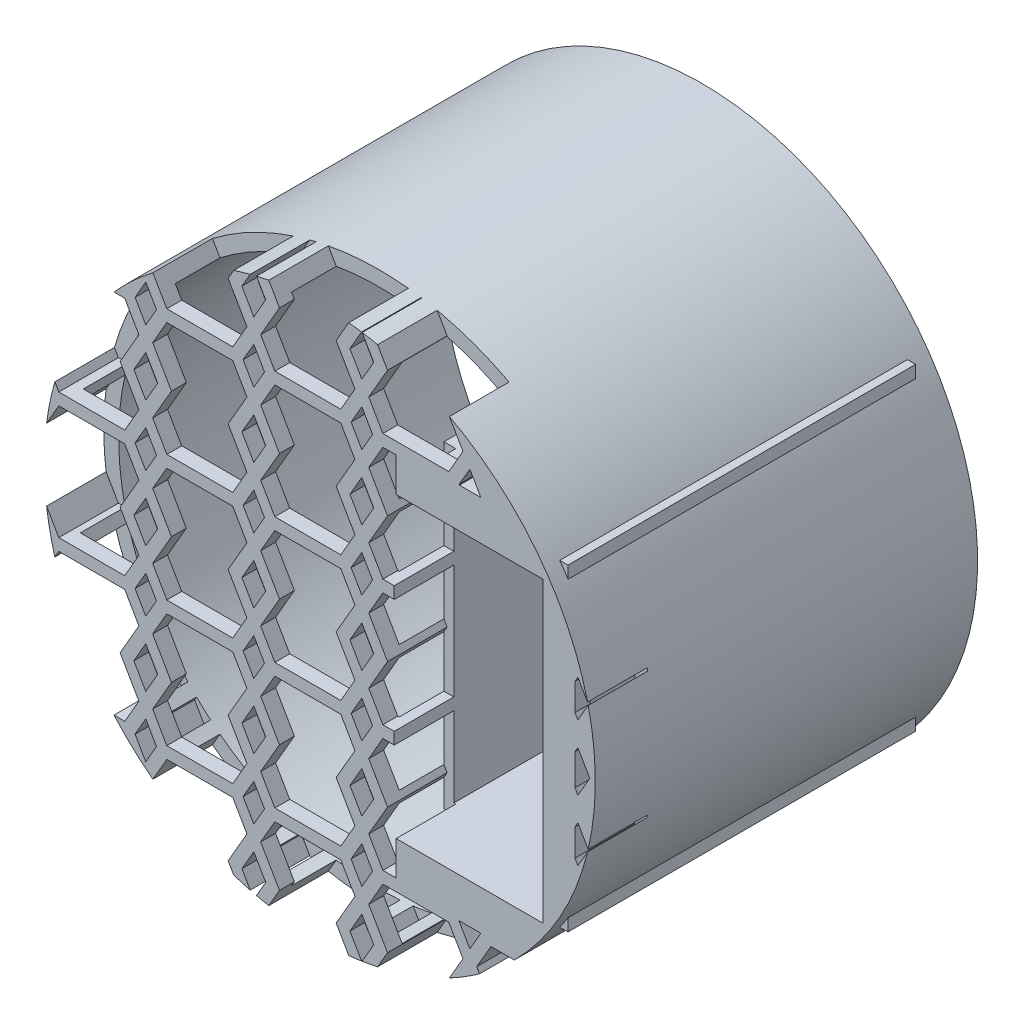
from build123d import *
from build123d.topology import SkipClean

# Parameters (mm, degrees)
SKETCH1_R           = 55.5
SKETCH1_W           = 30
SKETCH1_H           = 60
BOSS_EXTRUDE1_DEPTH = 3
SKETCH2_W           = 34
SKETCH2_H           = 64
SKETCH2_W_2         = 30
SKETCH2_H_2         = 60
BOSS_EXTRUDE2_DEPTH = 70
BOSS_EXTRUDE3_START = 74
SKETCH3_R           = 55.5
SKETCH3_R_2         = 52.5
BOSS_EXTRUDE3_DEPTH = 74
BOSS_EXTRUDE7_START = 3
BOSS_EXTRUDE7_DEPTH = 3
SKETCH7_R           = 1.5
BOSS_EXTRUDE8_DEPTH = 3
CUT_EXTRUDE1_DEPTH  = 12
CUT_EXTRUDE2_DEPTH  = 12


with BuildPart() as part:
    # Sketch1 → Boss-Extrude1 (new body)
    with BuildSketch(Plane.XY):
        Circle(SKETCH1_R)
        with Locations((30, 0)):
            Rectangle(SKETCH1_W, SKETCH1_H, mode=Mode.SUBTRACT)
    extrude(amount=BOSS_EXTRUDE1_DEPTH)

    # Sketch2 → Boss-Extrude2 (add)
    with BuildSketch(Plane(origin=(0, 0, 0), x_dir=(-1, 0, 0), z_dir=(0, 0, -1))):
        with Locations((-30, 0)):
            Rectangle(SKETCH2_W, SKETCH2_H)
        with Locations((-30, 0)):
            Rectangle(SKETCH2_W_2, SKETCH2_H_2, mode=Mode.SUBTRACT)
    extrude(amount=BOSS_EXTRUDE2_DEPTH)

    # Sketch3 → Boss-Extrude3 (add)
    with SkipClean():  # the faces are left unmerged after this step: merging them gives an invalid solid
        with BuildSketch(Plane(origin=(0, 0, 0), x_dir=(-1, 0, 0), z_dir=(0, 0, -1)).offset(BOSS_EXTRUDE3_START)):
            Circle(SKETCH3_R)
            with Locations(Location((0, 0, 0), (0, 0, 153.539028773))):
                Circle(SKETCH3_R_2, mode=Mode.SUBTRACT)
        extrude(amount=-BOSS_EXTRUDE3_DEPTH)
    add(part.part.scale(1), mode=Mode.REPLACE)  # the faces are merged on a copy

    # Sketch4 → Boss-Extrude7 (add)
    with BuildSketch(Plane(origin=(0, 0, -70), x_dir=(-1, 0, 0), z_dir=(0, 0, -1)).offset(BOSS_EXTRUDE7_START)):
        with BuildLine():
            Line((-43.084219849, -30), (-47, 23.393375131))
            ThreePointArc((-47, 23.393375131), (-46.036153719, 25.237324557), (-45, 27.041634566))
            Line((-45, 27.041634566), (-16.4, 37))
            Line((-16.4, 37), (-16.4, -37))
            Line((-16.4, -37), (-41.620307543, -32))
            ThreePointArc((-41.620307543, -32), (-42.364067796, -31.008640083), (-43.084219849, -30))
        make_face()
    extrude(amount=-BOSS_EXTRUDE7_DEPTH)

    # Sketch7 → Boss-Extrude8 (add)
    # profile 1 of 3: a face of its own
    with SkipClean():  # the faces are left unmerged after this step: merging them gives an invalid solid
        with BuildSketch(Plane(origin=(0, 0, -74), x_dir=(-1, 0, 0), z_dir=(0, 0, -1))):
            with BuildLine():
                Line((-10, -51.53882032), (-10, -39.53882032))
                Line((-10, -39.53882032), (10, -39.53882032))
                Line((10, -39.53882032), (10, -51.53882032))
                ThreePointArc((10, -51.53882032), (0, -52.5), (-10, -51.53882032))
            make_face()
            with Locations((0, -45)):
                Circle(SKETCH7_R, mode=Mode.SUBTRACT)
        # profile 2 of 3: a face of its own
        with BuildSketch(Plane(origin=(0, 0, -74), x_dir=(-1, 0, 0), z_dir=(0, 0, -1))):
            with BuildLine():
                Line((10, 51.53882032), (10, 39.53882032))
                Line((10, 39.53882032), (-10, 39.53882032))
                Line((-10, 39.53882032), (-10, 51.53882032))
                ThreePointArc((-10, 51.53882032), (0, 52.5), (10, 51.53882032))
            make_face()
            with Locations((0, 45)):
                Circle(SKETCH7_R, mode=Mode.SUBTRACT)
        # profile 3 of 3: a face of its own
        with BuildSketch(Plane(origin=(0, 0, -74), x_dir=(-1, 0, 0), z_dir=(0, 0, -1))):
            with BuildLine():
                Line((51.53882032, -10), (39.53882032, -10))
                Line((39.53882032, -10), (39.53882032, 10))
                Line((39.53882032, 10), (51.53882032, 10))
                ThreePointArc((51.53882032, 10), (52.5, 0), (51.53882032, -10))
            make_face()
            with Locations((45, 0)):
                Circle(SKETCH7_R, mode=Mode.SUBTRACT)
        extrude(amount=-BOSS_EXTRUDE8_DEPTH)

    # Sketch9 → Cut-Extrude1 (cut)
    with SkipClean():  # the faces are left unmerged after this step: merging them gives an invalid solid
        with BuildSketch(Plane.XY.offset(3)):
            with BuildLine():
                Line((-52.560824722, 13.9), (-39.281768531, 13.9))
                Line((-39.281768531, 13.9), (-36.427881081, 18.843078062))
                Line((-36.427881081, 18.843078062), (-40.213521727, 25.4))
                Line((-40.213521727, 25.4), (-36.427881081, 31.956921938))
                Line((-36.427881081, 31.956921938), (-39.281768531, 36.9))
                Line((-39.281768531, 36.9), (-43.444102016, 36.9))
                ThreePointArc((-43.444102016, 36.9), (-49.910820133, 27.530165884), (-54.386447784, 17.062071898))
                Line((-54.386447784, 17.062071898), (-52.560824722, 13.9))
            make_face()
            Polygon((-35.042240435, 16.443078062), (-37.203307562, 12.7), (-35.042240435, 8.956921938), (-32.881173308, 12.7), align=None)
            Polygon((-37.442240435, 25.4), (-35.042240435, 21.243078062), (-32.642240435, 25.4), (-35.042240435, 29.556921938), align=None)
            Polygon((-30.802712339, 11.5), (-33.656599789, 6.556921938), (-29.870959143, 0), (-33.656599789, -6.556921938), (-30.802712339, -11.5), (-17.523656148, -11.5), (-14.669768698, -6.556921938), (-18.455409344, 0), (-14.669768698, 6.556921938), (-17.523656148, 11.5), align=None)
            with BuildLine():
                Line((-40.213521727, 0), (-36.427881081, 6.556921938))
                Line((-36.427881081, 6.556921938), (-39.281768531, 11.5))
                Line((-39.281768531, 11.5), (-52.560824722, 11.5))
                Line((-52.560824722, 11.5), (-56.855069607, 4.06214968))
                ThreePointArc((-56.855069607, 4.06214968), (-57, 0), (-56.855069607, -4.06214968))
                Line((-56.855069607, -4.06214968), (-52.560824722, -11.5))
                Line((-52.560824722, -11.5), (-39.281768531, -11.5))
                Line((-39.281768531, -11.5), (-36.427881081, -6.556921938))
                Line((-36.427881081, -6.556921938), (-40.213521727, 0))
            make_face()
            Polygon((-29.870959143, 25.4), (-33.656599789, 18.843078062), (-30.802712339, 13.9), (-17.523656148, 13.9), (-14.669768698, 18.843078062), (-18.455409344, 25.4), (-14.669768698, 31.956921938), (-17.523656148, 36.9), (-30.802712339, 36.9), (-33.656599789, 31.956921938), align=None)
            Polygon((-32.642240435, 0), (-35.042240435, 4.156921938), (-37.442240435, 0), (-35.042240435, -4.156921938), align=None)
            Polygon((-37.203307562, 38.1), (-35.042240435, 34.356921938), (-32.881173308, 38.1), (-35.042240435, 41.843078062), align=None)
            Polygon((-10.884128052, 0), (-13.284128052, 4.156921938), (-15.684128052, 0), (-13.284128052, -4.156921938), align=None)
            Polygon((-15.445195179, 12.7), (-13.284128052, 8.956921938), (-11.123060926, 12.7), (-13.284128052, 16.443078062), align=None)
            Polygon((-15.684128052, 25.4), (-13.284128052, 21.243078062), (-10.884128052, 25.4), (-13.284128052, 29.556921938), align=None)
            with BuildLine():
                Line((-31.94545962, 47.206859774), (-33.656599789, 44.243078062))
                Line((-33.656599789, 44.243078062), (-30.802712339, 39.3))
                Line((-30.802712339, 39.3), (-17.523656148, 39.3))
                Line((-17.523656148, 39.3), (-14.669768698, 44.243078062))
                Line((-14.669768698, 44.243078062), (-18.455409344, 50.8))
                Line((-18.455409344, 50.8), (-16.239753763, 54.637628039))
                ThreePointArc((-16.239753763, 54.637628039), (-24.377402988, 51.524190664), (-31.94545962, 47.206859774))
            make_face()
            Polygon((-9.044599957, 11.5), (-11.898487406, 6.556921938), (-8.11284676, 0), (-11.898487406, -6.556921938), (-9.044599957, -11.5), (4.234456235, -11.5), (7.088343684, -6.556921938), (3.302703038, 0), (7.088343684, 6.556921938), (4.234456235, 11.5), align=None)
            Polygon((-8.11284676, 25.4), (-11.898487406, 18.843078062), (-9.044599957, 13.9), (4.234456235, 13.9), (7.088343684, 18.843078062), (3.302703038, 25.4), (7.088343684, 31.956921938), (4.234456235, 36.9), (-9.044599957, 36.9), (-11.898487406, 31.956921938), align=None)
            Polygon((-15.445195179, 38.1), (-13.284128052, 34.356921938), (-11.123060926, 38.1), (-13.284128052, 41.843078062), align=None)
            Polygon((12.713512426, -11.5), (15.4, -11.5), (15.4, 11.5), (12.713512426, 11.5), (9.859624977, 6.556921938), (13.645265623, 0), (9.859624977, -6.556921938), align=None)
            Polygon((-15.684128052, 50.8), (-13.284128052, 46.643078062), (-10.884128052, 50.8), (-13.284128052, 54.956921938), align=None)
            with BuildLine():
                Line((-8.11284676, 50.8), (-11.898487406, 44.243078062))
                Line((-11.898487406, 44.243078062), (-9.044599957, 39.3))
                Line((-9.044599957, 39.3), (4.234456235, 39.3))
                Line((4.234456235, 39.3), (7.088343684, 44.243078062))
                Line((7.088343684, 44.243078062), (3.302703038, 50.8))
                Line((3.302703038, 50.8), (6.657064227, 56.609924005))
                ThreePointArc((6.657064227, 56.609924005), (-2.23177374, 56.956291891), (-11.066255472, 55.915453945))
                Line((-11.066255472, 55.915453945), (-8.11284676, 50.8))
            make_face()
            Polygon((10.873984331, 0), (8.473984331, 4.156921938), (6.073984331, 0), (8.473984331, -4.156921938), align=None)
            Polygon((6.312917204, 12.7), (8.473984331, 8.956921938), (10.635051457, 12.7), (8.473984331, 16.443078062), align=None)
            Polygon((6.073984331, 25.4), (8.473984331, 21.243078062), (10.873984331, 25.4), (8.473984331, 29.556921938), align=None)
            Polygon((12.713512426, 13.9), (15.4, 13.9), (15.4, 36.9), (12.713512426, 36.9), (9.859624977, 31.956921938), (13.645265623, 25.4), (9.859624977, 18.843078062), align=None)
            Polygon((51.4, -3.134649797), (51.990209096, -4.156921938), (54.390209096, 0), (51.990209096, 4.156921938), (51.4, 3.134649797), align=None)
            Polygon((6.312917204, 38.1), (8.473984331, 34.356921938), (10.635051457, 38.1), (8.473984331, 41.843078062), align=None)
            Polygon((6.073984331, 50.8), (8.473984331, 46.643078062), (10.873984331, 50.8), (8.473984331, 54.956921938), align=None)
            Polygon((51.4, 15.420805921), (51.4, 9.979194079), (51.990209096, 8.956921938), (54.151276223, 12.7), (51.990209096, 16.443078062), align=None)
            with BuildLine():
                Line((13.645265623, 50.8), (9.859624977, 44.243078062))
                Line((9.859624977, 44.243078062), (12.713512426, 39.3))
                Line((12.713512426, 39.3), (25.992568618, 39.3))
                Line((25.992568618, 39.3), (28.846456067, 44.243078062))
                Line((28.846456067, 44.243078062), (25.060815421, 50.8))
                Line((25.060815421, 50.8), (25.238566441, 51.107873797))
                ThreePointArc((25.238566441, 51.107873797), (18.107387911, 54.047409772), (10.644633075, 55.997248028))
                Line((10.644633075, 55.997248028), (13.645265623, 50.8))
            make_face()
            Polygon((30.232096713, 41.843078062), (28.071029587, 38.1), (28.128764614, 38), (32.335428813, 38), (32.39316384, 38.1), align=None)
        extrude(amount=-CUT_EXTRUDE1_DEPTH, mode=Mode.SUBTRACT)

    # Sketch10 → Cut-Extrude2 (cut)
    with SkipClean():  # the faces are left unmerged after this step: merging them gives an invalid solid
        with BuildSketch(Plane.XY.offset(3)):
            with BuildLine():
                Line((-39.281768531, -36.9), (-36.427881081, -31.956921938))
                Line((-36.427881081, -31.956921938), (-40.213521727, -25.4))
                Line((-40.213521727, -25.4), (-36.427881081, -18.843078062))
                Line((-36.427881081, -18.843078062), (-39.281768531, -13.9))
                Line((-39.281768531, -13.9), (-52.560824722, -13.9))
                Line((-52.560824722, -13.9), (-54.386447784, -17.062071898))
                ThreePointArc((-54.386447784, -17.062071898), (-49.910820133, -27.530165884), (-43.444102016, -36.9))
                Line((-43.444102016, -36.9), (-39.281768531, -36.9))
            make_face()
            Polygon((-17.523656148, -36.9), (-14.669768698, -31.956921938), (-18.455409344, -25.4), (-14.669768698, -18.843078062), (-17.523656148, -13.9), (-30.802712339, -13.9), (-33.656599789, -18.843078062), (-29.870959143, -25.4), (-33.656599789, -31.956921938), (-30.802712339, -36.9), align=None)
            Polygon((-37.442240435, -25.4), (-35.042240435, -29.556921938), (-32.642240435, -25.4), (-35.042240435, -21.243078062), align=None)
            Polygon((-35.042240435, -16.443078062), (-32.881173308, -12.7), (-35.042240435, -8.956921938), (-37.203307562, -12.7), align=None)
            Polygon((-13.284128052, -16.443078062), (-11.123060926, -12.7), (-13.284128052, -8.956921938), (-15.445195179, -12.7), align=None)
            Polygon((8.473984331, -16.443078062), (10.635051457, -12.7), (8.473984331, -8.956921938), (6.312917204, -12.7), align=None)
            Polygon((4.234456235, -36.9), (7.088343684, -31.956921938), (3.302703038, -25.4), (7.088343684, -18.843078062), (4.234456235, -13.9), (-9.044599957, -13.9), (-11.898487406, -18.843078062), (-8.11284676, -25.4), (-11.898487406, -31.956921938), (-9.044599957, -36.9), align=None)
            Polygon((6.073984331, -25.4), (8.473984331, -29.556921938), (10.873984331, -25.4), (8.473984331, -21.243078062), align=None)
            Polygon((-15.684128052, -25.4), (-13.284128052, -29.556921938), (-10.884128052, -25.4), (-13.284128052, -21.243078062), align=None)
            Polygon((12.713512426, -36.9), (15.4, -36.9), (15.4, -13.9), (12.713512426, -13.9), (9.859624977, -18.843078062), (13.645265623, -25.4), (9.859624977, -31.956921938), align=None)
            with BuildLine():
                ThreePointArc((-31.94545962, -47.206859774), (-24.377402988, -51.524190664), (-16.239753763, -54.637628039))
                Line((-16.239753763, -54.637628039), (-18.455409344, -50.8))
                Line((-18.455409344, -50.8), (-14.669768698, -44.243078062))
                Line((-14.669768698, -44.243078062), (-17.523656148, -39.3))
                Line((-17.523656148, -39.3), (-30.802712339, -39.3))
                Line((-30.802712339, -39.3), (-33.656599789, -44.243078062))
                Line((-33.656599789, -44.243078062), (-31.94545962, -47.206859774))
            make_face()
            Polygon((-37.203307562, -38.1), (-35.042240435, -41.843078062), (-32.881173308, -38.1), (-35.042240435, -34.356921938), align=None)
            with BuildLine():
                ThreePointArc((-41.285711814, -39.3), (-39.137603015, -41.439691483), (-36.87875912, -43.462134391))
                Line((-36.87875912, -43.462134391), (-39.281768531, -39.3))
                Line((-39.281768531, -39.3), (-41.285711814, -39.3))
            make_face()
            Polygon((-15.445195179, -38.1), (-13.284128052, -41.843078062), (-11.123060926, -38.1), (-13.284128052, -34.356921938), align=None)
            with BuildLine():
                ThreePointArc((-11.066255472, -55.915453945), (-2.23177374, -56.956291891), (6.657064227, -56.609924005))
                Line((6.657064227, -56.609924005), (3.302703038, -50.8))
                Line((3.302703038, -50.8), (7.088343684, -44.243078062))
                Line((7.088343684, -44.243078062), (4.234456235, -39.3))
                Line((4.234456235, -39.3), (-9.044599957, -39.3))
                Line((-9.044599957, -39.3), (-11.898487406, -44.243078062))
                Line((-11.898487406, -44.243078062), (-8.11284676, -50.8))
                Line((-8.11284676, -50.8), (-11.066255472, -55.915453945))
            make_face()
            Polygon((-15.684128052, -50.8), (-13.284128052, -54.956921938), (-10.884128052, -50.8), (-13.284128052, -46.643078062), align=None)
            Polygon((6.073984331, -50.8), (8.473984331, -54.956921938), (10.873984331, -50.8), (8.473984331, -46.643078062), align=None)
            with BuildLine():
                Line((25.060815421, -50.8), (28.846456067, -44.243078062))
                Line((28.846456067, -44.243078062), (25.992568618, -39.3))
                Line((25.992568618, -39.3), (12.713512426, -39.3))
                Line((12.713512426, -39.3), (9.859624977, -44.243078062))
                Line((9.859624977, -44.243078062), (13.645265623, -50.8))
                Line((13.645265623, -50.8), (10.644633075, -55.997248028))
                ThreePointArc((10.644633075, -55.997248028), (18.107387911, -54.047409772), (25.238566441, -51.107873797))
                Line((25.238566441, -51.107873797), (25.060815421, -50.8))
            make_face()
            Polygon((8.473984331, -41.843078062), (10.635051457, -38.1), (8.473984331, -34.356921938), (6.312917204, -38.1), align=None)
            with BuildLine():
                ThreePointArc((32.933869261, -46.522685386), (37.285095545, -43.114053976), (41.285711814, -39.3))
                Line((41.285711814, -39.3), (34.471624809, -39.3))
                Line((34.471624809, -39.3), (31.617737359, -44.243078062))
                Line((31.617737359, -44.243078062), (32.933869261, -46.522685386))
            make_face()
            Polygon((32.39316384, -38.1), (32.335428813, -38), (28.128764614, -38), (28.071029587, -38.1), (30.232096713, -41.843078062), align=None)
            Polygon((51.4, -15.420805921), (51.990209096, -16.443078062), (54.151276223, -12.7), (51.990209096, -8.956921938), (51.4, -9.979194079), align=None)
            with BuildLine():
                ThreePointArc((53.635619444, -19.293012384), (54.011308677, -18.214788908), (54.365325092, -17.129256483))
                Line((54.365325092, -17.129256483), (53.375849742, -18.843078062))
                Line((53.375849742, -18.843078062), (53.635619444, -19.293012384))
            make_face()
            with BuildLine():
                Line((51.4, -22.265350203), (51.4, -24.638181751))
                ThreePointArc((51.4, -24.638181751), (51.97358519, -23.403983476), (52.517540391, -22.156442658))
                Line((52.517540391, -22.156442658), (51.990209096, -21.243078062))
                Line((51.990209096, -21.243078062), (51.4, -22.265350203))
            make_face()
        extrude(amount=-CUT_EXTRUDE2_DEPTH, mode=Mode.SUBTRACT)


solid = part.part
